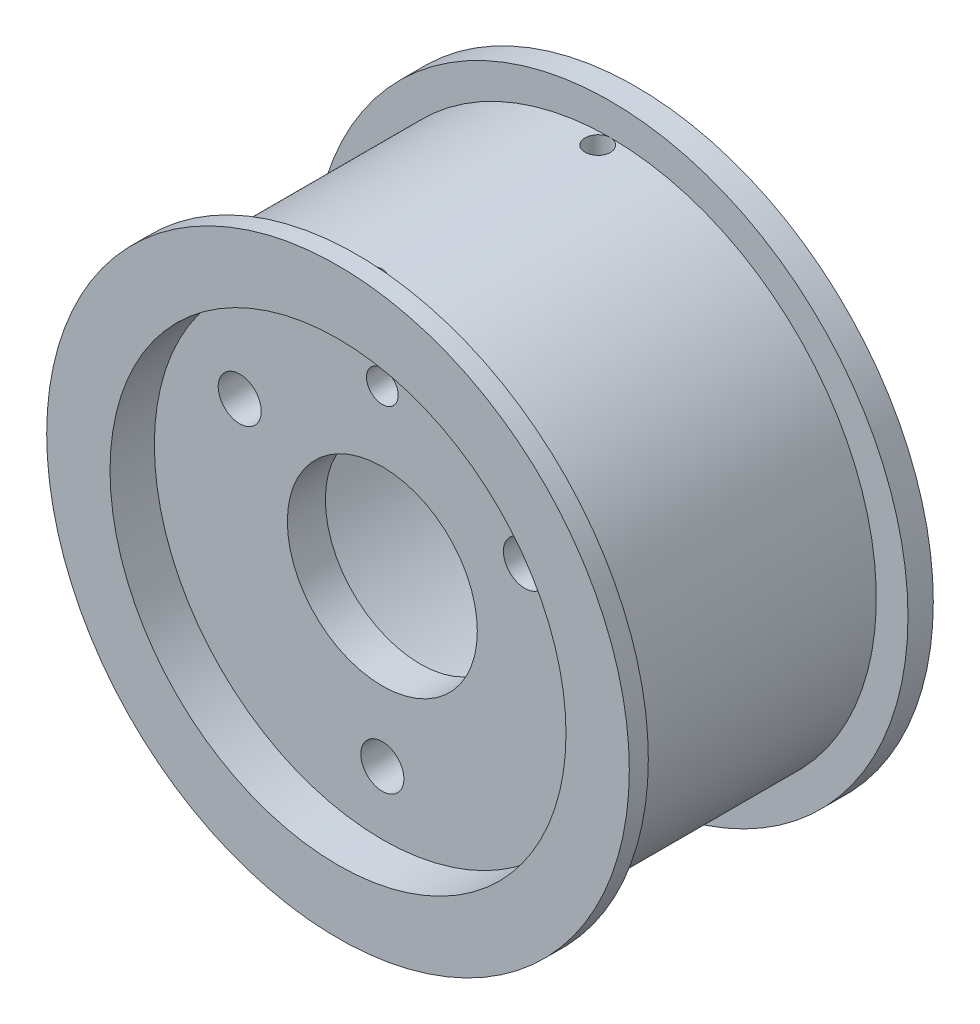
from build123d import *

# Parameters (mm, degrees)
HOLE_WIZARD_M3_1_D     = 3.4
HOLE_WIZARD_M3_1_DEPTH = 23
HOLE_WIZARD_M3_1_TIP   = 1.021463052
SKETCH_4_W             = 2
SKETCH_4_H             = 1.5
SKETCH_4_W_2           = 2.5
SKETCH_4_H_2           = 2
SKETCH_6_R             = 1
CUT_EXTRUDE_1_DEPTH    = 36.25
SKETCH_7_R             = 1
CUT_EXTRUDE_2_DEPTH    = 39.787884758
HOLE_WIZARD_M3_1_2_D   = 2.5


with BuildPart() as part:
    # 草图1 → 旋转1 (revolve)
    with BuildSketch(Plane(origin=(0, 0, 0), x_dir=(0, 0, -1), z_dir=(1, 0, 0))):
        Polygon((-11.75, 21), (-11.75, 18), (-8.25, 18), (-8.25, 7.5), (-5.25, 7.5), (-5.25, 18), (11.75, 18), (11.75, 21), align=None)
    revolve(axis=Axis((0, 0, 11.75), (0, 0, -1)))

    # Hole Wizard M3 _1
    with Locations(Plane.XY.offset(8.25)):
        with Locations((11.258330249, 6.5), (0, -13), (-11.258330249, 6.5)):
            Hole(HOLE_WIZARD_M3_1_D / 2, depth=HOLE_WIZARD_M3_1_DEPTH)
            with Locations((0, 0, -(HOLE_WIZARD_M3_1_DEPTH + HOLE_WIZARD_M3_1_TIP / 2))):  # 118° drill point
                Cone(0, HOLE_WIZARD_M3_1_D / 2, HOLE_WIZARD_M3_1_TIP, mode=Mode.SUBTRACT)

    # 草图4 → Revolve 1802 (revolve)
    with BuildSketch(Plane(origin=(0, 0, 0), x_dir=(1, 0, 0), z_dir=(0, 1, 0))):
        with Locations((22, -11)):
            Rectangle(SKETCH_4_W, SKETCH_4_H)
        with Locations((22.25, 10.75)):
            Rectangle(SKETCH_4_W_2, SKETCH_4_H_2)
    revolve(axis=Axis((0, 0, 10.547281455), (0, 0, -1)))

    # 草图6 → 切除-拉伸1 (cut, through all)
    with BuildSketch(Plane(origin=(0, 0, 0), x_dir=(1, 0, 0), z_dir=(0, 1, 0))):
        with Locations((0, 8.75)):
            Circle(SKETCH_6_R)
        with Locations((0, -9.25)):
            Circle(SKETCH_6_R)
    extrude(amount=CUT_EXTRUDE_1_DEPTH, mode=Mode.SUBTRACT)

    # 草图7 → 切除-拉伸2 (cut, through all)
    with BuildSketch(Plane.XY.offset(8.25)):
        with Locations((0, 17)):
            Circle(SKETCH_7_R)
    extrude(amount=-CUT_EXTRUDE_2_DEPTH, mode=Mode.SUBTRACT)

    # Hole Wizard M3 _1 2 (through all)
    with Locations(Plane.XY.offset(8.25)):
        with Locations((0, 13)):
            Hole(HOLE_WIZARD_M3_1_2_D / 2)


solid = part.part
